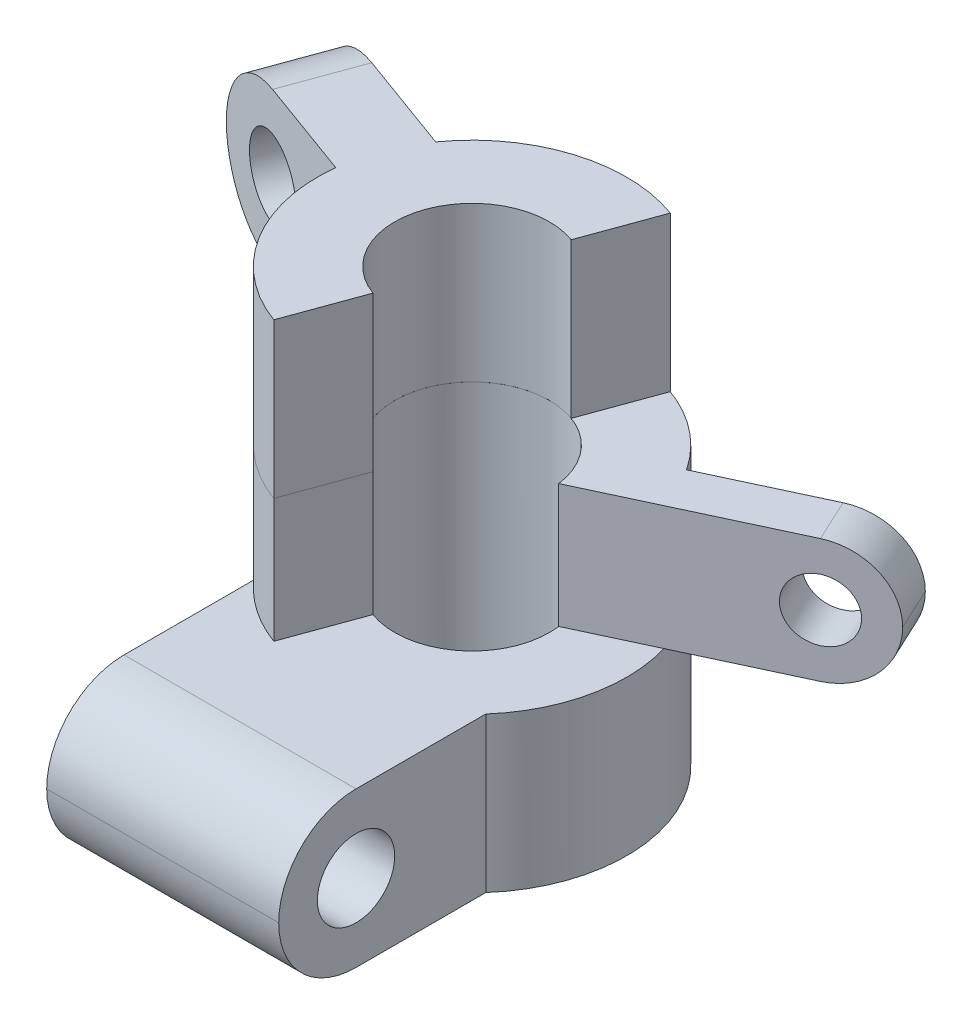
from build123d import *
from build123d.topology import SkipClean

# Parameters (mm, degrees)
EXTRUDE_4_DEPTH     = 20
FILLET_2_R          = 10
SKETCH_5_R          = 5
CUT_EXTRUDE_1_DEPTH = 73.284161474
EXTRUDE_START       = 16
EXTRUDE_6_DEPTH     = 20
FILLET_3_R          = 10
SKETCH_9_R          = 5
CUT_EXTRUDE_2_DEPTH = 78.613189577
EXTRUDE_7_DEPTH     = 16
FILLET_4_R          = 8
SKETCH_13_R         = 4
CUT_EXTRUDE_3_DEPTH = 95.259541887
EXTRUDE_8_DEPTH     = 16


with BuildPart() as part:
    # 草图1 → 凸台-拉伸4 (new body)
    with BuildSketch(Plane(origin=(0, 0, 0), x_dir=(1, 0, 0), z_dir=(0, 1, 0))):
        with BuildLine():
            ThreePointArc((15, 60), (-3.228756555, 48.228756555), (0, 26.771243445))
            ThreePointArc((0, 26.771243445), (6.771243445, 21.771243445), (15, 20))
            Line((15, 20), (15, 30))
            ThreePointArc((15, 30), (5, 40), (15, 50))
            Line((15, 50), (15, 60))
        make_face()
        with BuildLine():
            ThreePointArc((35, 40), (29.142135624, 54.142135624), (15, 60))
            Line((15, 60), (15, 50))
            ThreePointArc((15, 50), (22.071067812, 47.071067812), (25, 40))
            ThreePointArc((25, 40), (22.071067812, 32.928932188), (15, 30))
            Line((15, 30), (15, 20))
            ThreePointArc((15, 20), (23.228756555, 21.771243445), (30, 26.771243445))
            ThreePointArc((30, 26.771243445), (33.708286934, 32.928932188), (35, 40))
        make_face()
        with BuildLine():
            ThreePointArc((15, 60), (-3.228756555, 48.228756555), (0, 26.771243445))
            ThreePointArc((0, 26.771243445), (6.771243445, 21.771243445), (15, 20))
            Line((15, 20), (15, 30))
            ThreePointArc((15, 30), (5, 40), (15, 50))
            Line((15, 50), (15, 60))
        make_face()
        with BuildLine():
            ThreePointArc((35, 40), (29.142135624, 54.142135624), (15, 60))
            Line((15, 60), (15, 50))
            ThreePointArc((15, 50), (22.071067812, 47.071067812), (25, 40))
            ThreePointArc((25, 40), (22.071067812, 32.928932188), (15, 30))
            Line((15, 30), (15, 20))
            ThreePointArc((15, 20), (23.228756555, 21.771243445), (30, 26.771243445))
            ThreePointArc((30, 26.771243445), (33.708286934, 32.928932188), (35, 40))
        make_face()
        with BuildLine():
            Line((0, 26.771243445), (0, 0))
            Line((0, 0), (15, 0))
            Line((15, 0), (15, 20))
            ThreePointArc((15, 20), (6.771243445, 21.771243445), (0, 26.771243445))
        make_face()
        with BuildLine():
            Line((15, 20), (15, 0))
            Line((15, 0), (30, 0))
            Line((30, 0), (30, 26.771243445))
            ThreePointArc((30, 26.771243445), (23.228756555, 21.771243445), (15, 20))
        make_face()
    extrude(amount=EXTRUDE_4_DEPTH)

    # 圆角2
    fillet_2_edges = [part.edges().sort_by_distance(p)[0] for p in [
        (15, 0, 0),
        (15, 20, 0),
    ]]
    fillet(fillet_2_edges, radius=FILLET_2_R - 0.0001)  # a hair under: the kernel refuses the full size

    # 草图5 → 切除-拉伸1 (cut, through all)
    with BuildSketch(Plane.ZY):
        with Locations((-10, 10)):
            Circle(SKETCH_5_R)
    extrude(amount=-CUT_EXTRUDE_1_DEPTH, mode=Mode.SUBTRACT)

    # 草图11 → 凸台-拉伸7 (add)
    with BuildSketch(Plane(origin=(0, 20, 0), x_dir=(1, 0, 0), z_dir=(0, 1, 0))):
        with BuildLine():
            Line((21.840402867, 58.793852416), (18.420201433, 49.396926208))
            ThreePointArc((18.420201433, 49.396926208), (22.803417949, 46.253532466), (24.916346187, 41.290766554))
            Line((24.916346187, 41.290766554), (55.247963432, 55.434631959))
            Line((55.247963432, 55.434631959), (52.694506253, 60.910538551))
            Line((52.694506253, 60.910538551), (31.641450271, 51.093337319))
            ThreePointArc((31.641450271, 51.093337319), (27.356125602, 55.726606758), (21.840402867, 58.793852416))
        make_face()
    extrude(amount=EXTRUDE_7_DEPTH)

    # 圆角4
    fillet_4_edges = [part.edges().sort_by_distance(p)[0] for p in [
        (53.971234843, 20, -58.172585255),
        (53.971234843, 36, -58.172585255),
    ]]
    fillet(fillet_4_edges, radius=FILLET_4_R - 0.0001)  # a hair under: the kernel refuses the full size

    # 草图13 → 切除-拉伸3 (cut, through all)
    with BuildSketch(Plane(origin=(-13.918524524, 0, -29.848372166), x_dir=(-0.9063077870366495, 0, 0.42261826174070066), z_dir=(-0.42261826174070066, 0, -0.9063077870366495))):
        with Locations((-65.499347275, 28)):
            Circle(SKETCH_13_R)
    extrude(amount=-CUT_EXTRUDE_3_DEPTH, mode=Mode.SUBTRACT)

    # 草图15 → 凸台-拉伸8 (add)
    with SkipClean():  # the faces are left unmerged after this step: merging them gives an invalid solid
        with BuildSketch(Plane(origin=(0, 20, 0), x_dir=(1, 0, 0), z_dir=(0, 1, 0))):
            with BuildLine():
                Line((11.579798567, 30.603073792), (8.159597133, 21.206147584))
                ThreePointArc((8.159597133, 21.206147584), (-3.793852416, 46.840402867), (21.840402867, 58.793852416))
                Line((21.840402867, 58.793852416), (18.420201433, 49.396926208))
                ThreePointArc((18.420201433, 49.396926208), (5.603073792, 43.420201433), (11.579798567, 30.603073792))
            make_face()
        extrude(amount=EXTRUDE_8_DEPTH)


with BuildPart() as body_2:
    # 草图7 → 凸台-拉伸6 (new body)
    with BuildSketch(Plane(origin=(0, 20, 0), x_dir=(1, 0, 0), z_dir=(0, 1, 0)).offset(EXTRUDE_START)):
        with BuildLine():
            Line((18.420201433, 49.396926208), (21.840402867, 58.793852416))
            ThreePointArc((21.840402867, 58.793852416), (18.472963553, 59.69615506), (15, 60))
            Line((15, 60), (15, 50))
            ThreePointArc((15, 50), (16.736481777, 49.84807753), (18.420201433, 49.396926208))
        make_face()
        with BuildLine():
            Line((15, 50), (15, 60))
            ThreePointArc((15, 60), (5.831214309, 57.774514591), (-1.297071505, 51.593336895))
            ThreePointArc((-1.297071505, 51.593336895), (-3.678158381, 47.150272687), (-4.872696835, 42.25298036))
            ThreePointArc((-4.872696835, 42.25298036), (-4.077402617, 33.995609158), (0, 26.771243445))
            ThreePointArc((0, 26.771243445), (3.73086639, 23.477087797), (8.159597133, 21.206147584))
            Line((8.159597133, 21.206147584), (11.579798567, 30.603073792))
            ThreePointArc((11.579798567, 30.603073792), (5.15192247, 41.736481777), (15, 50))
        make_face()
        with BuildLine():
            ThreePointArc((-4.872696835, 42.25298036), (-3.678158381, 47.150272687), (-1.297071505, 51.593336895))
            Line((-1.297071505, 51.593336895), (-23.696681977, 59.746128366))
            Line((-23.696681977, 59.746128366), (-27.11688341, 50.349202158))
            Line((-27.11688341, 50.349202158), (-4.872696835, 42.25298036))
        make_face()
    extrude(amount=EXTRUDE_6_DEPTH)

    # 圆角3
    fillet_3_edges = [body_2.edges().sort_by_distance(p)[0] for p in [
        (-25.406782694, 36, -55.047665262),
        (-25.406782694, 56, -55.047665262),
    ]]
    fillet(fillet_3_edges, radius=FILLET_3_R - 0.0001)  # a hair under: the kernel refuses the full size

    # 草图9 → 切除-拉伸2 (cut, through all)
    with BuildSketch(Plane(origin=(13.009848873, 0, -35.744266009), x_dir=(0.9396926207859082, 0, 0.34202014332566943), z_dir=(-0.34202014332566943, 0, 0.9396926207859082))):
        with Locations((-32.701976578, 46)):
            Circle(SKETCH_9_R)
    extrude(amount=-CUT_EXTRUDE_2_DEPTH, mode=Mode.SUBTRACT)


solid = Compound([part.part, body_2.part])
